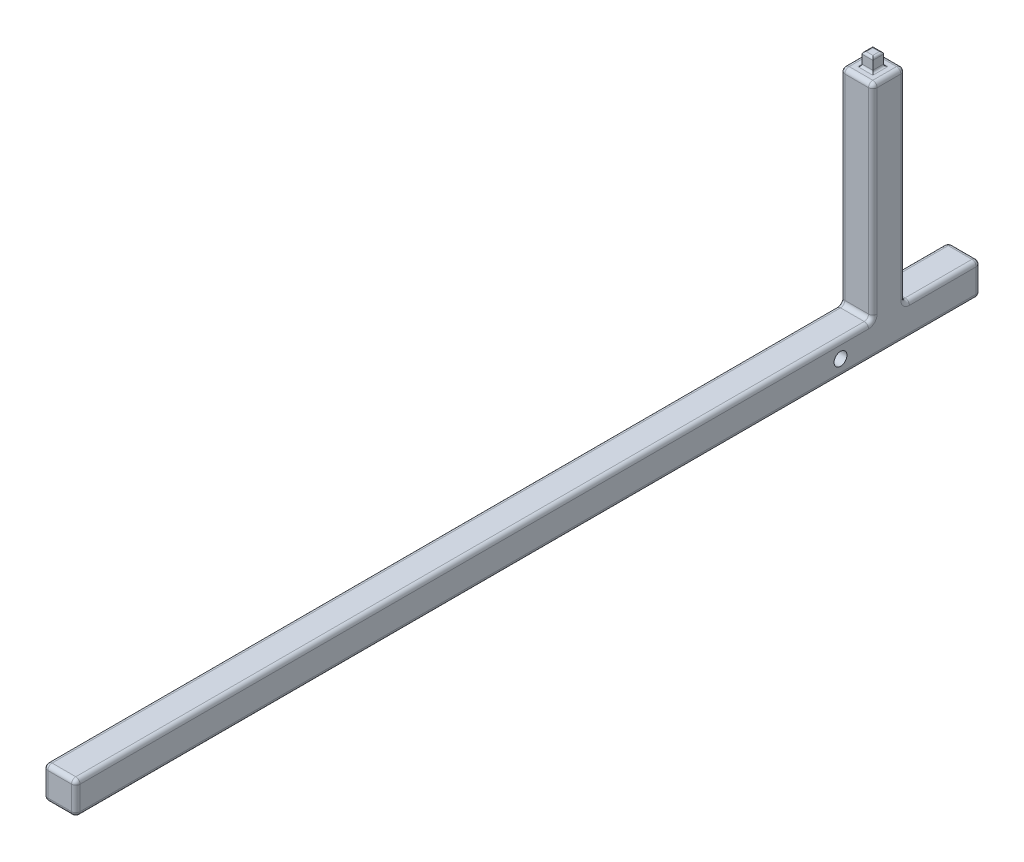
from build123d import *

# Parameters (mm, degrees)
SKETCH13_W          = 15
SKETCH13_H          = 15
BOSS_EXTRUDE3_DEPTH = 420
BOSS_EXTRUDE4_START = -70
SKETCH12_W          = 15
SKETCH12_H          = 15
BOSS_EXTRUDE4_DEPTH = 110
SKETCH14_W          = 5
SKETCH14_H          = 5
BOSS_EXTRUDE5_DEPTH = 6
FILLET1_R           = 2
FILLET2_R           = 1
FILLET3_R           = 2
FILLET4_R           = 2
SKETCH15_R          = 3
CUT_EXTRUDE1_DEPTH  = 402.04987221


with BuildPart() as part:
    # Sketch13 → Boss-Extrude3 (new body)
    with BuildSketch(Plane.XY.offset(-50)):
        with Locations((0, 45.5)):
            Rectangle(SKETCH13_W, SKETCH13_H)
    extrude(amount=BOSS_EXTRUDE3_DEPTH)

    # Sketch12 → Boss-Extrude4 (add)
    with BuildSketch(Plane(origin=(0, 108, 0), x_dir=(1, 0, 0), z_dir=(0, 1, 0)).offset(BOSS_EXTRUDE4_START)):
        with Locations((0, 7.5)):
            Rectangle(SKETCH12_W, SKETCH12_H)
    extrude(amount=BOSS_EXTRUDE4_DEPTH)

    # Sketch14 → Boss-Extrude5 (add)
    with BuildSketch(Plane(origin=(0, 148, 0), x_dir=(1, 0, 0), z_dir=(0, 1, 0))):
        with Locations((0, 7.5)):
            Rectangle(SKETCH14_W, SKETCH14_H)
    extrude(amount=BOSS_EXTRUDE5_DEPTH)

    # Fillet1
    fillet1_edges = [part.edges().sort_by_distance(p)[0] for p in [
        (-7.5, 45.5, 370),
        (0, 38, 370),
        (-7.5, 53, -32.5),
        (7.5, 53, -32.5),
        (-7.5, 100.5, -15),
        (-7.5, 100.5, 0),
        (0, 53, 0),
        (7.5, 100.5, 0),
        (7.5, 100.5, -15),
        (0, 53, -15),
        (-7.5, 148, -7.5),
        (0, 148, 0),
        (7.5, 148, -7.5),
        (0, 148, -15),
        (0, 38, -50),
        (-7.5, 45.5, -50),
        (7.5, 45.5, -50),
        (7.5, 38, 160),
        (-7.5, 38, 160),
        (-7.5, 53, 185),
        (7.5, 53, 185),
        (0, 53, 370),
    ]]
    fillet(fillet1_edges, radius=FILLET1_R)

    # Fillet2
    fillet2_edges = [part.edges().sort_by_distance(p)[0] for p in [
        (2.5, 148, -7.5),
        (0, 148, -10),
        (-2.5, 148, -7.5),
        (0, 148, -5),
        (2.5, 154, -7.5),
        (0, 154, -10),
        (-2.5, 154, -7.5),
        (0, 154, -5),
    ]]
    fillet(fillet2_edges, radius=FILLET2_R)

    # Fillet3
    # the kernel refuses this fillet: 2 mm, written as the material it takes off along each edge
    with BuildSketch(Plane(origin=(5.5, 51, 368), x_dir=(0, 0, 1), z_dir=(1, 0, 0))) as fillet3_piece_1_section:
        Polygon((0, 0), (FILLET3_R, 0), (FILLET3_R, -FILLET3_R), (0, -FILLET3_R), align=None)
    fillet3_piece_1 = extrude(amount=FILLET3_R, mode=Mode.PRIVATE)
    fillet3_piece_1 = fillet3_piece_1 - Plane(origin=(5.5, 51, 368), x_dir=(0, -0.7071067811865475, -0.7071067811865475), z_dir=(1, 0, 0)) * Sphere(FILLET3_R, mode=Mode.PRIVATE)
    add(fillet3_piece_1, mode=Mode.SUBTRACT)
    with BuildSketch(Plane(origin=(5.5, 40, 368), x_dir=(0, 0, 1), z_dir=(1, 0, 0))) as fillet3_piece_2_section:
        Polygon((0, 0), (FILLET3_R, 0), (FILLET3_R, FILLET3_R), (0, FILLET3_R), align=None)
    fillet3_piece_2 = extrude(amount=FILLET3_R, mode=Mode.PRIVATE)
    fillet3_piece_2 = fillet3_piece_2 - Plane(origin=(5.5, 40, 368), x_dir=(0, 0.7071067811865475, -0.7071067811865475), z_dir=(1, 0, 0)) * Sphere(FILLET3_R, mode=Mode.PRIVATE)
    add(fillet3_piece_2, mode=Mode.SUBTRACT)
    with BuildSketch(Plane(origin=(7.5, 51, 370), x_dir=(0, 0, -1), z_dir=(0, -1, 0))) as fillet3_piece_3:
        with BuildLine():
            CenterArc((FILLET3_R, -FILLET3_R), FILLET3_R, 90, 90)
            Line((0, -FILLET3_R), (0, 0))
            Line((0, 0), (FILLET3_R, 0))
        make_face()
    extrude(amount=11, mode=Mode.SUBTRACT)

    # Fillet4
    # the kernel refuses this fillet: 2 mm, written as the material it takes off along each edge
    with BuildSketch(Plane(origin=(-5.5, 51, -48), x_dir=(0, 1, 0), z_dir=(0, 0, -1))) as fillet4_piece_1_section:
        Polygon((0, 0), (FILLET4_R, 0), (FILLET4_R, -FILLET4_R), (0, -FILLET4_R), align=None)
    fillet4_piece_1 = extrude(amount=FILLET4_R, mode=Mode.PRIVATE)
    fillet4_piece_1 = fillet4_piece_1 - Plane(origin=(-5.5, 51, -48), x_dir=(0.7071067811865472, -0.7071067811865478, 0), z_dir=(0, 0, -1)) * Sphere(FILLET4_R, mode=Mode.PRIVATE)
    add(fillet4_piece_1, mode=Mode.SUBTRACT)
    with BuildSketch(Plane(origin=(5.5, 51, -48), x_dir=(0, 1, 0), z_dir=(0, 0, -1))) as fillet4_piece_2_section:
        Polygon((0, 0), (FILLET4_R, 0), (FILLET4_R, FILLET4_R), (0, FILLET4_R), align=None)
    fillet4_piece_2 = extrude(amount=FILLET4_R, mode=Mode.PRIVATE)
    fillet4_piece_2 = fillet4_piece_2 - Plane(origin=(5.5, 51, -48), x_dir=(-0.7071067811865479, -0.7071067811865472, 0), z_dir=(0, 0, -1)) * Sphere(FILLET4_R, mode=Mode.PRIVATE)
    add(fillet4_piece_2, mode=Mode.SUBTRACT)
    with BuildSketch(Plane(origin=(-5.5, 53, -50), x_dir=(0, -1, 0), z_dir=(1, 0, 0))) as fillet4_piece_3:
        with BuildLine():
            CenterArc((FILLET4_R, -FILLET4_R), FILLET4_R, 90, 90)
            Line((0, -FILLET4_R), (0, 0))
            Line((0, 0), (FILLET4_R, 0))
        make_face()
    extrude(amount=11, mode=Mode.SUBTRACT)

    # Sketch15 → Cut-Extrude1 (cut, through all)
    with BuildSketch(Plane.ZY.offset(7.5)):
        with Locations(Location((15, 45.5, 0), (0, 0, 270))):
            Circle(SKETCH15_R)
    extrude(amount=-CUT_EXTRUDE1_DEPTH, mode=Mode.SUBTRACT)


solid = part.part
